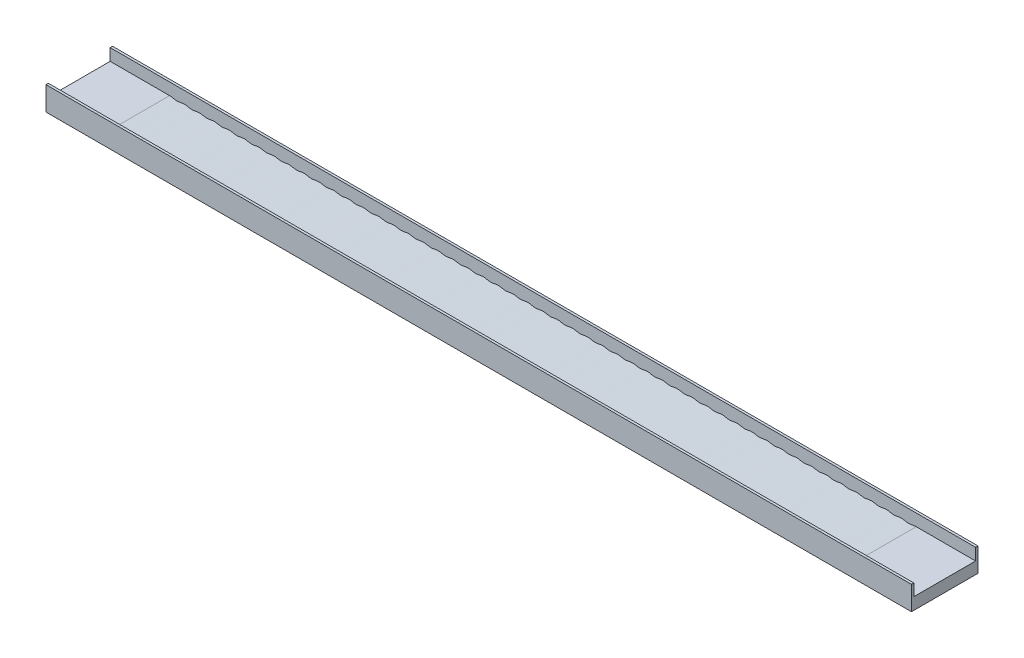
from build123d import *

# Parameters (mm, degrees)
EXTRUDE_START   = -1300
EXTRUDE_1_DEPTH = 2600
SKETCH_2_W      = 36415.926536001
SKETCH_2_H      = 1000
EXTRUDE_2_DEPTH = 100


# Read off the part's stored shape, not the designer's step: 凸台-拉伸1
with BuildPart() as part:
    # 凸台-拉伸1 outline → 凸台-拉伸1 (new body)
    with BuildSketch(Plane.XY.offset(EXTRUDE_START)):
        with BuildLine():
            Line((-2228.431761558, 20), (-2228.431761558, -480))
            Line((-2228.431761558, -480), (34187.494774443, -480))
            Line((34187.494774443, -480), (34187.494774443, 20))
            Line((34187.494774443, 20), (31687.494773895, 20))
            add(Edge.make_bspline(
                [(31687.494773895, 20), (31686.890061757, 20), (31685.675166212, 19.997851704), (31683.062154629, 19.98496191), (31679.221873173, 19.939866932), (31674.817946535, 19.849773248), (31669.718948116, 19.695711247), (31664.658657992, 19.491009688), (31659.580450049, 19.236275388), (31654.516075853, 18.932259102), (31649.448701702, 18.579852537), (31644.388230065, 18.180080275), (31639.329784909, 17.734098815), (31634.276468062, 17.243181554), (31627.964797009, 16.575112414), (31620.40032269, 15.689341218), (31609.588625545, 14.279473843), (31595.552999597, 12.189578684), (31581.558869258, 9.837617702), (31567.599816606, 7.28941057), (31553.150824515, 4.525924227), (31538.20846992, 1.568769901), (31520.787282594, -1.938535557), (31501.31254045, -5.784438998), (31482.247501309, -9.333774724), (31463.124048505, -12.556952307), (31443.930897977, -15.34178292), (31424.207399888, -17.616794123), (31403.957729748, -19.233695632), (31383.659901075, -20.065316007), (31363.344788012, -20.072105346), (31343.046405636, -19.25391055), (31322.795744152, -17.649271079), (31298.564531469, -14.867808911), (31269.436240062, -10.386147052), (31235.496124316, -3.949926792), (31202.132402779, 2.901028706), (31173.156764933, 8.478235794), (31151.571278896, 12.117923296), (31137.453877582, 14.227436657), (31122.826294393, 16.14228476), (31110.205895577, 17.526506503), (31097.560066907, 18.614869746), (31086.131702214, 19.308406214), (31078.487421897, 19.647157342), (31072.069852185, 19.844802847), (31066.93000964, 19.951171552), (31062.950475899, 19.991558407), (31055.497368984, 20.016205606), (31044.8424148, 19.877769953), (31030.581169714, 19.332419567), (31011.642094127, 17.914657935), (30991.048527765, 15.680198246), (30965.858597727, 12.103537366), (30936.148493176, 6.850524777), (30901.941099866, -0.032006323), (30867.7328091, -6.91070951), (30838.021145733, -12.15466432), (30812.829485137, -15.720192356), (30792.234915419, -17.943749607), (30773.373817468, -19.344481907), (30754.473840125, -20.059593001), (30735.56011551, -20.059593001), (30716.660138168, -19.344481907), (30697.799040216, -17.943749607), (30677.204470498, -15.720192356), (30652.012809902, -12.15466432), (30622.301146536, -6.91070951), (30588.09285577, -0.032006323), (30553.885462459, 6.850524777), (30524.175357908, 12.103537366), (30498.98542787, 15.680198246), (30478.391861509, 17.914657935), (30459.452785921, 19.332419567), (30445.198068785, 19.877798715), (30430.857712459, 20.061609484), (30416.517356133, 19.877798715), (30402.262638996, 19.332419567), (30383.323563409, 17.914657935), (30362.729997047, 15.680198246), (30337.540067009, 12.103537366), (30307.829962459, 6.850524777), (30273.622569148, -0.032006323), (30239.414278382, -6.91070951), (30209.702615015, -12.15466432), (30184.51095442, -15.720192356), (30163.916384702, -17.943749607), (30145.05528675, -19.344481907), (30126.155309407, -20.059593001), (30107.241584792, -20.059593001), (30088.34160745, -19.344481907), (30069.480509498, -17.943749607), (30048.88593978, -15.720192356), (30023.694279184, -12.15466432), (29993.982615818, -6.91070951), (29959.774325052, -0.032006323), (29925.566931741, 6.850524777), (29895.85682719, 12.103537366), (29870.666897152, 15.680198246), (29850.073330791, 17.914657935), (29831.134255203, 19.332419567), (29816.879538067, 19.877798715), (29802.539181741, 20.061609484), (29788.198825415, 19.877798715), (29773.944108278, 19.332419567), (29755.005032691, 17.914657935), (29734.411466329, 15.680198246), (29709.221536291, 12.103537366), (29679.51143174, 6.850524777), (29645.30403843, -0.032006323), (29611.095747664, -6.91070951), (29581.384084297, -12.15466432), (29556.192423702, -15.720192356), (29535.597853984, -17.943749607), (29516.736756032, -19.344481907), (29497.836778689, -20.059593001), (29478.923054074, -20.059593001), (29460.023076732, -19.344481907), (29441.16197878, -17.943749607), (29420.567409062, -15.720192356), (29395.375748466, -12.15466432), (29365.6640851, -6.91070951), (29331.455794334, -0.032006323), (29297.248401023, 6.850524777), (29267.538296472, 12.103537366), (29242.348366435, 15.680198246), (29221.754800073, 17.914657935), (29202.815724485, 19.332419567), (29188.561007349, 19.877798715), (29174.220651023, 20.061609484), (29159.880294697, 19.877798715), (29145.62557756, 19.332419567), (29126.686501973, 17.914657935), (29106.092935611, 15.680198246), (29080.903005573, 12.103537366), (29051.192901022, 6.850524777), (29016.985507712, -0.032006323), (28982.777216946, -6.91070951), (28953.065553579, -12.15466432), (28927.873892984, -15.720192356), (28907.279323266, -17.943749607), (28888.418225314, -19.344481907), (28869.518247972, -20.059593001), (28850.604523356, -20.059593001), (28831.704546014, -19.344481907), (28812.843448062, -17.943749607), (28792.248878344, -15.720192356), (28767.057217748, -12.15466432), (28737.345554382, -6.91070951), (28703.137263616, -0.032006323), (28668.929870305, 6.850524777), (28639.219765755, 12.103537366), (28614.029835717, 15.680198246), (28593.436269355, 17.914657935), (28574.497193767, 19.332419567), (28560.242476631, 19.877798715), (28545.902120305, 20.061609484), (28531.561763979, 19.877798715), (28517.307046842, 19.332419567), (28498.367971255, 17.914657935), (28477.774404893, 15.680198246), (28452.584474855, 12.103537366), (28422.874370305, 6.850524777), (28388.666976994, -0.032006323), (28354.458686228, -6.91070951), (28324.747022861, -12.15466432), (28299.555362266, -15.720192356), (28278.960792548, -17.943749607), (28260.099694596, -19.344481907), (28241.199717254, -20.059593001), (28222.285992638, -20.059593001), (28203.386015296, -19.344481907), (28184.524917344, -17.943749607), (28163.930347626, -15.720192356), (28138.73868703, -12.15466432), (28109.027023664, -6.91070951), (28074.818732898, -0.032006323), (28040.611339587, 6.850524777), (28010.901235037, 12.103537366), (27985.711304999, 15.680198246), (27965.117738637, 17.914657935), (27946.178663049, 19.332419567), (27931.923945913, 19.877798715), (27917.583589587, 20.061609484), (27903.243233261, 19.877798715), (27888.988516125, 19.332419567), (27870.049440537, 17.914657935), (27849.455874175, 15.680198246), (27824.265944137, 12.103537366), (27794.555839587, 6.850524777), (27760.348446276, -0.032006323), (27726.14015551, -6.91070951), (27696.428492143, -12.15466432), (27671.236831548, -15.720192356), (27650.64226183, -17.943749607), (27631.781163878, -19.344481907), (27612.881186536, -20.059593001), (27593.96746192, -20.059593001), (27575.067484578, -19.344481907), (27556.206386626, -17.943749607), (27535.611816908, -15.720192356), (27510.420156312, -12.15466432), (27480.708492946, -6.91070951), (27446.50020218, -0.032006323), (27412.292808869, 6.850524777), (27382.582704319, 12.103537366), (27357.392774281, 15.680198246), (27336.799207919, 17.914657935), (27317.860132331, 19.332419567), (27303.605415195, 19.877798715), (27289.265058869, 20.061609484), (27274.924702543, 19.877798715), (27260.669985407, 19.332419567), (27241.730909819, 17.914657935), (27221.137343457, 15.680198246), (27195.947413419, 12.103537366), (27166.237308869, 6.850524777), (27132.029915558, -0.032006323), (27097.821624792, -6.91070951), (27068.109961425, -12.15466432), (27042.91830083, -15.720192356), (27022.323731112, -17.943749607), (27003.46263316, -19.344481907), (26984.562655818, -20.059593001), (26965.648931202, -20.059593001), (26946.74895386, -19.344481907), (26927.887855908, -17.943749607), (26907.29328619, -15.720192356), (26882.101625594, -12.15466432), (26852.389962228, -6.91070951), (26818.181671462, -0.032006323), (26783.974278151, 6.850524777), (26754.264173601, 12.103537366), (26729.074243563, 15.680198246), (26708.480677201, 17.914657935), (26689.541601613, 19.332419567), (26675.286884477, 19.877798715), (26660.946528151, 20.061609484), (26646.606171825, 19.877798715), (26632.351454689, 19.332419567), (26613.412379101, 17.914657935), (26592.818812739, 15.680198246), (26567.628882701, 12.103537366), (26537.918778151, 6.850524777), (26503.71138484, -0.032006323), (26469.503094074, -6.91070951), (26439.791430707, -12.15466432), (26414.599770112, -15.720192356), (26394.005200394, -17.943749607), (26375.144102442, -19.344481907), (26356.2441251, -20.059593001), (26337.330400484, -20.059593001), (26318.430423142, -19.344481907), (26299.56932519, -17.943749607), (26278.974755472, -15.720192356), (26253.783094877, -12.15466432), (26224.07143151, -6.91070951), (26189.863140744, -0.032006323), (26155.655747433, 6.850524777), (26125.945642883, 12.103537366), (26100.755712845, 15.680198246), (26080.162146483, 17.914657935), (26061.223070895, 19.332419567), (26046.968353759, 19.877798715), (26032.627997433, 20.061609484), (26018.287641107, 19.877798715), (26004.032923971, 19.332419567), (25985.093848383, 17.914657935), (25964.500282021, 15.680198246), (25939.310351983, 12.103537366), (25909.600247433, 6.850524777), (25875.392854122, -0.032006323), (25841.184563356, -6.91070951), (25811.47289999, -12.15466432), (25786.281239394, -15.720192356), (25765.686669676, -17.943749607), (25746.825571724, -19.344481907), (25727.925594382, -20.059593001), (25709.011869766, -20.059593001), (25690.111892424, -19.344481907), (25671.250794472, -17.943749607), (25650.656224754, -15.720192356), (25625.464564159, -12.15466432), (25595.752900792, -6.91070951), (25561.544610026, -0.032006323), (25527.337216715, 6.850524777), (25497.627112165, 12.103537366), (25472.437182127, 15.680198246), (25451.843615765, 17.914657935), (25432.904540177, 19.332419567), (25418.649823041, 19.877798715), (25404.309466715, 20.061609484), (25389.969110389, 19.877798715), (25375.714393253, 19.332419567), (25356.775317665, 17.914657935), (25336.181751303, 15.680198246), (25310.991821265, 12.103537366), (25281.281716715, 6.850524777), (25247.074323404, -0.032006323), (25212.866032638, -6.91070951), (25183.154369271, -12.15466432), (25157.962708676, -15.720192356), (25137.368138958, -17.943749607), (25118.507041006, -19.344481907), (25099.607063664, -20.059593001), (25080.693339048, -20.059593001), (25061.793361706, -19.344481907), (25042.932263754, -17.943749607), (25022.337694036, -15.720192356), (24997.146033441, -12.15466432), (24967.434370074, -6.91070951), (24933.226079308, -0.032006323), (24899.018685997, 6.850524777), (24869.308581447, 12.103537366), (24844.118651409, 15.680198246), (24823.525085047, 17.914657935), (24804.58600946, 19.332419567), (24790.331292323, 19.877798715), (24775.990935997, 20.061609484), (24761.650579671, 19.877798715), (24747.395862535, 19.332419567), (24728.456786947, 17.914657935), (24707.863220585, 15.680198246), (24682.673290547, 12.103537366), (24652.963185997, 6.850524777), (24618.755792686, -0.032006323), (24584.54750192, -6.91070951), (24554.835838553, -12.15466432), (24529.644177958, -15.720192356), (24509.04960824, -17.943749607), (24490.188510288, -19.344481907), (24471.288532946, -20.059593001), (24452.37480833, -20.059593001), (24433.474830988, -19.344481907), (24414.613733036, -17.943749607), (24394.019163318, -15.720192356), (24368.827502723, -12.15466432), (24339.115839356, -6.91070951), (24304.90754859, -0.032006323), (24270.700155279, 6.850524777), (24240.990050729, 12.103537366), (24215.800120691, 15.680198246), (24195.206554329, 17.914657935), (24176.267478742, 19.332419567), (24162.012761605, 19.877798715), (24147.672405279, 20.061609484), (24133.332048953, 19.877798715), (24119.077331817, 19.332419567), (24100.138256229, 17.914657935), (24079.544689867, 15.680198246), (24054.35475983, 12.103537366), (24024.644655279, 6.850524777), (23990.437261968, -0.032006323), (23956.228971202, -6.91070951), (23926.517307836, -12.15466432), (23901.32564724, -15.720192356), (23880.731077522, -17.943749607), (23861.86997957, -19.344481907), (23842.970002228, -20.059593001), (23824.056277612, -20.059593001), (23805.15630027, -19.344481907), (23786.295202318, -17.943749607), (23765.7006326, -15.720192356), (23740.508972005, -12.15466432), (23710.797308638, -6.91070951), (23676.589017872, -0.032006323), (23642.381624561, 6.850524777), (23612.671520011, 12.103537366), (23587.481589973, 15.680198246), (23566.888023611, 17.914657935), (23547.948948024, 19.332419567), (23533.694230887, 19.877798715), (23519.353874561, 20.061609484), (23505.013518235, 19.877798715), (23490.758801099, 19.332419567), (23471.819725511, 17.914657935), (23451.226159149, 15.680198246), (23426.036229112, 12.103537366), (23396.326124561, 6.850524777), (23362.11873125, -0.032006323), (23327.910440484, -6.91070951), (23298.198777118, -12.15466432), (23273.007116522, -15.720192356), (23252.412546804, -17.943749607), (23233.551448852, -19.344481907), (23214.65147151, -20.059593001), (23195.737746895, -20.059593001), (23176.837769552, -19.344481907), (23157.9766716, -17.943749607), (23137.382101882, -15.720192356), (23112.190441287, -12.15466432), (23082.47877792, -6.91070951), (23048.270487154, -0.032006323), (23014.063093843, 6.850524777), (22984.352989293, 12.103537366), (22959.163059255, 15.680198246), (22938.569492893, 17.914657935), (22919.630417306, 19.332419567), (22905.375700169, 19.877798715), (22891.035343843, 20.061609484), (22876.694987517, 19.877798715), (22862.440270381, 19.332419567), (22843.501194793, 17.914657935), (22822.907628432, 15.680198246), (22797.717698393, 12.103537366), (22768.007593843, 6.850524777), (22733.800200532, -0.032006323), (22699.591909766, -6.91070951), (22669.8802464, -12.15466432), (22644.688585804, -15.720192356), (22624.094016086, -17.943749607), (22605.232918134, -19.344481907), (22586.332940792, -20.059593001), (22567.419216176, -20.059593001), (22548.519238834, -19.344481907), (22529.658140883, -17.943749607), (22509.063571165, -15.720192356), (22483.871910569, -12.15466432), (22454.160247202, -6.91070951), (22419.951956436, -0.032006323), (22385.744563125, 6.850524777), (22356.034458575, 12.103537366), (22330.844528537, 15.680198246), (22310.250962175, 17.914657935), (22291.311886588, 19.332419567), (22277.057169451, 19.877798715), (22262.716813125, 20.061609484), (22248.376456799, 19.877798715), (22234.121739663, 19.332419567), (22215.182664075, 17.914657935), (22194.589097713, 15.680198246), (22169.399167676, 12.103537366), (22139.689063125, 6.850524777), (22105.481669814, -0.032006323), (22071.273379048, -6.91070951), (22041.561715682, -12.15466432), (22016.370055086, -15.720192356), (21995.775485368, -17.943749607), (21976.914387416, -19.344481907), (21958.014410074, -20.059593001), (21939.100685459, -20.059593001), (21920.200708116, -19.344481907), (21901.339610165, -17.943749607), (21880.745040447, -15.720192356), (21855.553379851, -12.15466432), (21825.841716484, -6.91070951), (21791.633425718, -0.032006323), (21757.426032408, 6.850524777), (21727.715927857, 12.103537366), (21702.525997819, 15.680198246), (21681.932431457, 17.914657935), (21662.99335587, 19.332419567), (21648.738638733, 19.877798715), (21634.398282407, 20.061609484), (21620.057926081, 19.877798715), (21605.803208945, 19.332419567), (21586.864133357, 17.914657935), (21566.270566996, 15.680198246), (21541.080636958, 12.103537366), (21511.370532407, 6.850524777), (21477.163139096, -0.032006323), (21442.95484833, -6.91070951), (21413.243184964, -12.15466432), (21388.051524368, -15.720192356), (21367.45695465, -17.943749607), (21348.595856698, -19.344481907), (21329.695879356, -20.059593001), (21310.782154741, -20.059593001), (21291.882177398, -19.344481907), (21273.021079447, -17.943749607), (21252.426509729, -15.720192356), (21227.234849133, -12.15466432), (21197.523185766, -6.91070951), (21163.314895, -0.032006323), (21129.10750169, 6.850524777), (21099.397397139, 12.103537366), (21074.207467101, 15.680198246), (21053.613900739, 17.914657935), (21034.674825152, 19.332419567), (21020.420108015, 19.877798715), (21006.079751689, 20.061609484), (20991.739395363, 19.877798715), (20977.484678227, 19.332419567), (20958.545602639, 17.914657935), (20937.952036278, 15.680198246), (20912.76210624, 12.103537366), (20883.052001689, 6.850524777), (20848.844608378, -0.032006323), (20814.636317612, -6.91070951), (20784.924654246, -12.15466432), (20759.73299365, -15.720192356), (20739.138423932, -17.943749607), (20720.27732598, -19.344481907), (20701.377348638, -20.059593001), (20682.463624023, -20.059593001), (20663.56364668, -19.344481907), (20644.702548729, -17.943749607), (20624.107979011, -15.720192356), (20598.916318415, -12.15466432), (20569.204655048, -6.91070951), (20534.996364282, -0.032006323), (20500.788970972, 6.850524777), (20471.078866421, 12.103537366), (20445.888936383, 15.680198246), (20425.295370021, 17.914657935), (20406.356294434, 19.332419567), (20392.101577297, 19.877798715), (20377.761220971, 20.061609484), (20363.420864645, 19.877798715), (20349.166147509, 19.332419567), (20330.227071921, 17.914657935), (20309.63350556, 15.680198246), (20284.443575522, 12.103537366), (20254.733470971, 6.850524777), (20220.52607766, -0.032006323), (20186.317786894, -6.91070951), (20156.606123528, -12.15466432), (20131.414462932, -15.720192356), (20110.819893214, -17.943749607), (20091.958795263, -19.344481907), (20073.05881792, -20.059593001), (20054.145093305, -20.059593001), (20035.245115962, -19.344481907), (20016.384018011, -17.943749607), (19995.789448293, -15.720192356), (19970.597787697, -12.15466432), (19940.88612433, -6.91070951), (19906.677833564, -0.032006323), (19872.470440254, 6.850524777), (19842.760335703, 12.103537366), (19817.570405665, 15.680198246), (19796.976839304, 17.914657935), (19778.037763716, 19.332419567), (19763.783046579, 19.877798715), (19749.442690253, 20.061609484), (19735.102333927, 19.877798715), (19720.847616791, 19.332419567), (19701.908541203, 17.914657935), (19681.314974842, 15.680198246), (19656.125044804, 12.103537366), (19626.414940253, 6.850524777), (19592.207546942, -0.032006323), (19557.999256176, -6.91070951), (19528.28759281, -12.15466432), (19503.095932214, -15.720192356), (19482.501362496, -17.943749607), (19463.640264545, -19.344481907), (19444.740287202, -20.059593001), (19425.826562587, -20.059593001), (19406.926585244, -19.344481907), (19388.065487293, -17.943749607), (19367.470917575, -15.720192356), (19342.279256979, -12.15466432), (19312.567593612, -6.91070951), (19278.359302846, -0.032006323), (19244.151909536, 6.850524777), (19214.441804985, 12.103537366), (19189.251874947, 15.680198246), (19168.658308586, 17.914657935), (19149.719232998, 19.332419567), (19135.464515861, 19.877798715), (19121.124159535, 20.061609484), (19106.783803209, 19.877798715), (19092.529086073, 19.332419567), (19073.590010485, 17.914657935), (19052.996444124, 15.680198246), (19027.806514086, 12.103537366), (18998.096409535, 6.850524777), (18963.889016225, -0.032006323), (18929.680725459, -6.91070951), (18899.969062092, -12.15466432), (18874.777401496, -15.720192356), (18854.182831778, -17.943749607), (18835.321733827, -19.344481907), (18816.421756484, -20.059593001), (18797.508031869, -20.059593001), (18778.608054526, -19.344481907), (18759.746956575, -17.943749607), (18739.152386857, -15.720192356), (18713.960726261, -12.15466432), (18684.249062894, -6.91070951), (18650.040772128, -0.032006323), (18615.833378818, 6.850524777), (18586.123274267, 12.103537366), (18560.933344229, 15.680198246), (18540.339777868, 17.914657935), (18521.40070228, 19.332419567), (18507.145985143, 19.877798715), (18492.805628817, 20.061609484), (18478.465272491, 19.877798715), (18464.210555355, 19.332419567), (18445.271479767, 17.914657935), (18424.677913406, 15.680198246), (18399.487983368, 12.103537366), (18369.777878817, 6.850524777), (18335.570485507, -0.032006323), (18301.362194741, -6.91070951), (18271.650531374, -12.15466432), (18246.458870778, -15.720192356), (18225.86430106, -17.943749607), (18207.003203109, -19.344481907), (18188.103225766, -20.059593001), (18169.189501151, -20.059593001), (18150.289523808, -19.344481907), (18131.428425857, -17.943749607), (18110.833856139, -15.720192356), (18085.642195543, -12.15466432), (18055.930532176, -6.91070951), (18021.72224141, -0.032006323), (17987.5148481, 6.850524777), (17957.804743549, 12.103537366), (17932.614813511, 15.680198246), (17912.02124715, 17.914657935), (17893.082171562, 19.332419567), (17878.827454426, 19.877798715), (17864.4870981, 20.061609484), (17850.146741774, 19.877798715), (17835.892024637, 19.332419567), (17816.952949049, 17.914657935), (17796.359382688, 15.680198246), (17771.16945265, 12.103537366), (17741.459348099, 6.850524777), (17707.251954789, -0.032006323), (17673.043664023, -6.91070951), (17643.332000656, -12.15466432), (17618.14034006, -15.720192356), (17597.545770342, -17.943749607), (17578.684672391, -19.344481907), (17559.784695048, -20.059593001), (17540.870970433, -20.059593001), (17521.970993091, -19.344481907), (17503.109895139, -17.943749607), (17482.515325421, -15.720192356), (17457.323664825, -12.15466432), (17427.612001458, -6.91070951), (17393.403710692, -0.032006323), (17359.196317382, 6.850524777), (17329.486212831, 12.103537366), (17304.296282793, 15.680198246), (17283.702716432, 17.914657935), (17264.763640844, 19.332419567), (17250.508923708, 19.877798715), (17236.168567382, 20.061609484), (17221.828211056, 19.877798715), (17207.573493919, 19.332419567), (17188.634418332, 17.914657935), (17168.04085197, 15.680198246), (17142.850921932, 12.103537366), (17113.140817381, 6.850524777), (17078.933424071, -0.032006323), (17044.725133305, -6.91070951), (17015.013469938, -12.15466432), (16989.821809342, -15.720192356), (16969.227239624, -17.943749607), (16950.366141673, -19.344481907), (16931.46616433, -20.059593001), (16912.552439715, -20.059593001), (16893.652462373, -19.344481907), (16874.791364421, -17.943749607), (16854.196794703, -15.720192356), (16829.005134107, -12.15466432), (16799.293470741, -6.91070951), (16765.085179974, -0.032006323), (16730.877786664, 6.850524777), (16701.167682113, 12.103537366), (16675.977752075, 15.680198246), (16655.384185714, 17.914657935), (16636.445110126, 19.332419567), (16622.19039299, 19.877798715), (16607.850036664, 20.061609484), (16593.509680338, 19.877798715), (16579.254963201, 19.332419567), (16560.315887613, 17.914657935), (16539.722321252, 15.680198246), (16514.532391214, 12.103537366), (16484.822286663, 6.850524777), (16450.614893353, -0.032006323), (16416.406602587, -6.91070951), (16386.69493922, -12.15466432), (16361.503278624, -15.720192356), (16340.908708906, -17.943749607), (16322.047610955, -19.344481907), (16303.147633612, -20.059593001), (16284.233908997, -20.059593001), (16265.333931655, -19.344481907), (16246.472833703, -17.943749607), (16225.878263985, -15.720192356), (16200.686603389, -12.15466432), (16170.974940023, -6.91070951), (16136.766649257, -0.032006323), (16102.559255946, 6.850524777), (16072.849151395, 12.103537366), (16047.659221357, 15.680198246), (16027.065654996, 17.914657935), (16008.126579408, 19.332419567), (15993.871862272, 19.877798715), (15979.531505946, 20.061609484), (15965.19114962, 19.877798715), (15950.936432483, 19.332419567), (15931.997356895, 17.914657935), (15911.403790534, 15.680198246), (15886.213860496, 12.103537366), (15856.503755945, 6.850524777), (15822.296362635, -0.032006323), (15788.088071869, -6.91070951), (15758.376408502, -12.15466432), (15733.184747906, -15.720192356), (15712.590178188, -17.943749607), (15693.729080237, -19.344481907), (15674.829102894, -20.059593001), (15655.915378279, -20.059593001), (15637.015400937, -19.344481907), (15618.154302985, -17.943749607), (15597.559733267, -15.720192356), (15572.368072671, -12.15466432), (15542.656409305, -6.91070951), (15508.448118538, -0.032006323), (15474.240725228, 6.850524777), (15444.530620677, 12.103537366), (15419.340690639, 15.680198246), (15398.747124278, 17.914657935), (15379.80804869, 19.332419567), (15365.553331554, 19.877798715), (15351.212975228, 20.061609484), (15336.872618902, 19.877798715), (15322.617901765, 19.332419567), (15303.678826178, 17.914657935), (15283.085259816, 15.680198246), (15257.895329778, 12.103537366), (15228.185225227, 6.850524777), (15193.977831917, -0.032006323), (15159.769541151, -6.91070951), (15130.057877784, -12.15466432), (15104.866217189, -15.720192356), (15084.27164747, -17.943749607), (15065.410549519, -19.344481907), (15046.510572176, -20.059593001), (15027.596847561, -20.059593001), (15008.696870219, -19.344481907), (14989.835772267, -17.943749607), (14969.241202549, -15.720192356), (14944.049541953, -12.15466432), (14914.337878587, -6.91070951), (14880.129587821, -0.032006323), (14845.92219451, 6.850524777), (14816.212089959, 12.103537366), (14791.022159921, 15.680198246), (14770.42859356, 17.914657935), (14751.489517972, 19.332419567), (14737.234800836, 19.877798715), (14722.89444451, 20.061609484), (14708.554088184, 19.877798715), (14694.299371047, 19.332419567), (14675.36029546, 17.914657935), (14654.766729098, 15.680198246), (14629.57679906, 12.103537366), (14599.866694509, 6.850524777), (14565.659301199, -0.032006323), (14531.451010433, -6.91070951), (14501.739347066, -12.15466432), (14476.54768647, -15.720192356), (14455.953116753, -17.943749607), (14437.092018801, -19.344481907), (14418.192041458, -20.059593001), (14399.278316843, -20.059593001), (14380.378339501, -19.344481907), (14361.517241549, -17.943749607), (14340.922671831, -15.720192356), (14315.731011235, -12.15466432), (14286.019347869, -6.91070951), (14251.811057103, -0.032006323), (14217.603663792, 6.850524777), (14187.893559241, 12.103537366), (14162.703629204, 15.680198246), (14142.110062842, 17.914657935), (14123.170987254, 19.332419567), (14108.916270118, 19.877798715), (14094.575913792, 20.061609484), (14080.235557466, 19.877798715), (14065.980840329, 19.332419567), (14047.041764742, 17.914657935), (14026.44819838, 15.680198246), (14001.258268342, 12.103537366), (13971.548163791, 6.850524777), (13937.340770481, -0.032006323), (13903.132479715, -6.91070951), (13873.420816348, -12.15466432), (13848.229155753, -15.720192356), (13827.634586035, -17.943749607), (13808.773488083, -19.344481907), (13789.87351074, -20.059593001), (13770.959786125, -20.059593001), (13752.059808783, -19.344481907), (13733.198710831, -17.943749607), (13712.604141113, -15.720192356), (13687.412480517, -12.15466432), (13657.700817151, -6.91070951), (13623.492526385, -0.032006323), (13589.285133074, 6.850524777), (13559.575028523, 12.103537366), (13534.385098485, 15.680198246), (13513.791532124, 17.914657935), (13494.852456536, 19.332419567), (13480.5977394, 19.877798715), (13466.257383074, 20.061609484), (13451.917026748, 19.877798715), (13437.662309611, 19.332419567), (13418.723234024, 17.914657935), (13398.129667662, 15.680198246), (13372.939737624, 12.103537366), (13343.229633074, 6.850524777), (13309.022239763, -0.032006323), (13274.813948997, -6.91070951), (13245.10228563, -12.15466432), (13219.910625035, -15.720192356), (13199.316055317, -17.943749607), (13180.454957365, -19.344481907), (13161.554980022, -20.059593001), (13142.641255407, -20.059593001), (13123.741278065, -19.344481907), (13104.880180113, -17.943749607), (13084.285610395, -15.720192356), (13059.093949799, -12.15466432), (13029.382286433, -6.91070951), (12995.173995667, -0.032006323), (12960.966602356, 6.850524777), (12931.256497805, 12.103537366), (12906.066567768, 15.680198246), (12885.473001406, 17.914657935), (12866.533925818, 19.332419567), (12852.279208682, 19.877798715), (12837.938852356, 20.061609484), (12823.59849603, 19.877798715), (12809.343778893, 19.332419567), (12790.404703306, 17.914657935), (12769.811136944, 15.680198246), (12744.621206906, 12.103537366), (12714.911102356, 6.850524777), (12680.703709045, -0.032006323), (12646.495418279, -6.91070951), (12616.783754912, -12.15466432), (12591.592094317, -15.720192356), (12570.997524599, -17.943749607), (12552.136426647, -19.344481907), (12533.236449305, -20.059593001), (12514.322724689, -20.059593001), (12495.422747347, -19.344481907), (12476.561649395, -17.943749607), (12455.967079677, -15.720192356), (12430.775419081, -12.15466432), (12401.063755715, -6.91070951), (12366.855464949, -0.032006323), (12332.648071638, 6.850524777), (12302.937967088, 12.103537366), (12277.74803705, 15.680198246), (12257.154470688, 17.914657935), (12238.2153951, 19.332419567), (12223.960677964, 19.877798715), (12209.620321638, 20.061609484), (12195.279965312, 19.877798715), (12181.025248175, 19.332419567), (12162.086172588, 17.914657935), (12141.492606226, 15.680198246), (12116.302676188, 12.103537366), (12086.592571638, 6.850524777), (12052.385178327, -0.032006323), (12018.176887561, -6.91070951), (11988.465224194, -12.15466432), (11963.273563599, -15.720192356), (11942.678993881, -17.943749607), (11923.817895929, -19.344481907), (11904.917918587, -20.059593001), (11886.004193971, -20.059593001), (11867.104216629, -19.344481907), (11848.243118677, -17.943749607), (11827.648548959, -15.720192356), (11802.456888364, -12.15466432), (11772.745224997, -6.91070951), (11738.536934231, -0.032006323), (11704.32954092, 6.850524777), (11674.61943637, 12.103537366), (11649.429506332, 15.680198246), (11628.83593997, 17.914657935), (11609.896864382, 19.332419567), (11595.642147246, 19.877798715), (11581.30179092, 20.061609484), (11566.961434594, 19.877798715), (11552.706717458, 19.332419567), (11533.76764187, 17.914657935), (11513.174075508, 15.680198246), (11487.98414547, 12.103537366), (11458.27404092, 6.850524777), (11424.066647609, -0.032006323), (11389.858356843, -6.91070951), (11360.146693476, -12.15466432), (11334.955032881, -15.720192356), (11314.360463163, -17.943749607), (11295.499365211, -19.344481907), (11276.599387869, -20.059593001), (11257.685663253, -20.059593001), (11238.785685911, -19.344481907), (11219.924587959, -17.943749607), (11199.330018241, -15.720192356), (11174.138357645, -12.15466432), (11144.426694279, -6.91070951), (11110.218403513, -0.032006323), (11076.011010202, 6.850524777), (11046.300905652, 12.103537366), (11021.110975614, 15.680198246), (11000.517409252, 17.914657935), (10981.578333664, 19.332419567), (10967.323616528, 19.877798715), (10952.983260202, 20.061609484), (10938.642903876, 19.877798715), (10924.38818674, 19.332419567), (10905.449111152, 17.914657935), (10884.85554479, 15.680198246), (10859.665614752, 12.103537366), (10829.955510202, 6.850524777), (10795.748116891, -0.032006323), (10761.539826125, -6.91070951), (10731.828162758, -12.15466432), (10706.636502163, -15.720192356), (10686.041932445, -17.943749607), (10667.180834493, -19.344481907), (10648.280857151, -20.059593001), (10629.367132535, -20.059593001), (10610.467155193, -19.344481907), (10591.606057241, -17.943749607), (10571.011487523, -15.720192356), (10545.819826927, -12.15466432), (10516.108163561, -6.91070951), (10481.899872795, -0.032006323), (10447.692479484, 6.850524777), (10417.982374934, 12.103537366), (10392.792444896, 15.680198246), (10372.198878534, 17.914657935), (10353.259802946, 19.332419567), (10339.00508581, 19.877798715), (10324.664729484, 20.061609484), (10310.324373158, 19.877798715), (10296.069656022, 19.332419567), (10277.130580434, 17.914657935), (10256.537014072, 15.680198246), (10231.347084034, 12.103537366), (10201.636979484, 6.850524777), (10167.429586173, -0.032006323), (10133.221295407, -6.91070951), (10103.50963204, -12.15466432), (10078.317971445, -15.720192356), (10057.723401727, -17.943749607), (10038.862303775, -19.344481907), (10019.962326433, -20.059593001), (10001.048601817, -20.059593001), (9982.148624475, -19.344481907), (9963.287526523, -17.943749607), (9942.692956805, -15.720192356), (9917.50129621, -12.15466432), (9887.789632843, -6.91070951), (9853.581342077, -0.032006323), (9819.373948766, 6.850524777), (9789.663844216, 12.103537366), (9764.473914178, 15.680198246), (9743.880347816, 17.914657935), (9724.941272228, 19.332419567), (9710.686555092, 19.877798715), (9696.346198766, 20.061609484), (9682.00584244, 19.877798715), (9667.751125304, 19.332419567), (9648.812049716, 17.914657935), (9628.218483354, 15.680198246), (9603.028553316, 12.103537366), (9573.318448766, 6.850524777), (9539.111055455, -0.032006323), (9504.902764689, -6.91070951), (9475.191101323, -12.15466432), (9449.999440727, -15.720192356), (9429.404871009, -17.943749607), (9410.543773057, -19.344481907), (9391.643795715, -20.059593001), (9372.730071099, -20.059593001), (9353.830093757, -19.344481907), (9334.968995805, -17.943749607), (9314.374426087, -15.720192356), (9289.182765492, -12.15466432), (9259.471102125, -6.91070951), (9225.262811359, -0.032006323), (9191.055418048, 6.850524777), (9161.345313498, 12.103537366), (9136.15538346, 15.680198246), (9115.561817098, 17.914657935), (9096.62274151, 19.332419567), (9082.368024374, 19.877798715), (9068.027668048, 20.061609484), (9053.687311722, 19.877798715), (9039.432594586, 19.332419567), (9020.493518998, 17.914657935), (8999.899952636, 15.680198246), (8974.710022598, 12.103537366), (8944.999918048, 6.850524777), (8910.792524737, -0.032006323), (8876.584233971, -6.91070951), (8846.872570605, -12.15466432), (8821.680910009, -15.720192356), (8801.086340291, -17.943749607), (8782.225242339, -19.344481907), (8763.325264997, -20.059593001), (8744.411540381, -20.059593001), (8725.511563039, -19.344481907), (8706.650465087, -17.943749607), (8686.055895369, -15.720192356), (8660.864234774, -12.15466432), (8631.152571407, -6.91070951), (8596.944280641, -0.032006323), (8562.73688733, 6.850524777), (8533.02678278, 12.103537366), (8507.836852742, 15.680198246), (8487.24328638, 17.914657935), (8468.304210793, 19.332419567), (8454.049493656, 19.877798715), (8439.70913733, 20.061609484), (8425.368781004, 19.877798715), (8411.114063868, 19.332419567), (8392.17498828, 17.914657935), (8371.581421918, 15.680198246), (8346.39149188, 12.103537366), (8316.68138733, 6.850524777), (8282.473994019, -0.032006323), (8248.265703253, -6.91070951), (8218.554039887, -12.15466432), (8193.362379291, -15.720192356), (8172.767809573, -17.943749607), (8153.906711621, -19.344481907), (8135.006734279, -20.059593001), (8116.093009663, -20.059593001), (8097.193032321, -19.344481907), (8078.331934369, -17.943749607), (8057.737364651, -15.720192356), (8032.545704056, -12.15466432), (8002.834040689, -6.91070951), (7968.625749923, -0.032006323), (7934.418356612, 6.850524777), (7904.708252062, 12.103537366), (7879.518322024, 15.680198246), (7858.924755662, 17.914657935), (7839.985680075, 19.332419567), (7825.730962938, 19.877798715), (7811.390606612, 20.061609484), (7797.050250286, 19.877798715), (7782.79553315, 19.332419567), (7763.856457562, 17.914657935), (7743.2628912, 15.680198246), (7718.072961163, 12.103537366), (7688.362856612, 6.850524777), (7654.155463301, -0.032006323), (7619.947172535, -6.91070951), (7590.235509169, -12.15466432), (7565.043848573, -15.720192356), (7544.449278855, -17.943749607), (7525.588180903, -19.344481907), (7506.688203561, -20.059593001), (7487.774478946, -20.059593001), (7468.874501603, -19.344481907), (7450.013403651, -17.943749607), (7429.418833933, -15.720192356), (7404.227173338, -12.15466432), (7374.515509971, -6.91070951), (7340.307219205, -0.032006323), (7306.099825894, 6.850524777), (7276.389721344, 12.103537366), (7251.199791306, 15.680198246), (7230.606224944, 17.914657935), (7211.667149357, 19.332419567), (7197.41243222, 19.877798715), (7183.072075894, 20.061609484), (7168.731719568, 19.877798715), (7154.477002432, 19.332419567), (7135.537926844, 17.914657935), (7114.944360483, 15.680198246), (7089.754430445, 12.103537366), (7060.044325894, 6.850524777), (7025.836932583, -0.032006323), (6991.628641817, -6.91070951), (6961.916978451, -12.15466432), (6936.725317855, -15.720192356), (6916.130748137, -17.943749607), (6897.269650185, -19.344481907), (6878.369672843, -20.059593001), (6859.455948228, -20.059593001), (6840.555970885, -19.344481907), (6821.694872933, -17.943749607), (6801.100303216, -15.720192356), (6775.90864262, -12.15466432), (6746.196979253, -6.91070951), (6711.988688487, -0.032006323), (6677.781295177, 6.850524777), (6648.071190626, 12.103537366), (6622.881260588, 15.680198246), (6602.287694226, 17.914657935), (6583.348618639, 19.332419567), (6569.093901502, 19.877798715), (6554.753545176, 20.061609484), (6540.41318885, 19.877798715), (6526.158471714, 19.332419567), (6507.219396126, 17.914657935), (6486.625829765, 15.680198246), (6461.435899727, 12.103537366), (6431.725795176, 6.850524777), (6397.518401865, -0.032006323), (6363.310111099, -6.91070951), (6333.598447733, -12.15466432), (6308.406787137, -15.720192356), (6287.812217419, -17.943749607), (6268.951119467, -19.344481907), (6250.051142125, -20.059593001), (6231.13741751, -20.059593001), (6212.237440167, -19.344481907), (6193.376342216, -17.943749607), (6172.781772498, -15.720192356), (6147.590111902, -12.15466432), (6117.878448535, -6.91070951), (6083.670157769, -0.032006323), (6049.462764459, 6.850524777), (6019.752659908, 12.103537366), (5994.56272987, 15.680198246), (5973.969163508, 17.914657935), (5955.030087921, 19.332419567), (5940.775370784, 19.877798715), (5926.435014458, 20.061609484), (5912.094658132, 19.877798715), (5897.839940996, 19.332419567), (5878.900865408, 17.914657935), (5858.307299047, 15.680198246), (5833.117369009, 12.103537366), (5803.407264458, 6.850524777), (5769.199871147, -0.032006323), (5734.991580381, -6.91070951), (5705.279917015, -12.15466432), (5680.088256419, -15.720192356), (5659.493686701, -17.943749607), (5640.632588749, -19.344481907), (5621.732611407, -20.059593001), (5602.818886792, -20.059593001), (5583.918909449, -19.344481907), (5565.057811498, -17.943749607), (5544.46324178, -15.720192356), (5519.271581184, -12.15466432), (5489.559917817, -6.91070951), (5455.351627051, -0.032006323), (5421.144233741, 6.850524777), (5391.43412919, 12.103537366), (5366.244199152, 15.680198246), (5345.65063279, 17.914657935), (5326.711557203, 19.332419567), (5312.456840066, 19.877798715), (5298.11648374, 20.061609484), (5283.776127414, 19.877798715), (5269.521410278, 19.332419567), (5250.58233469, 17.914657935), (5229.988768329, 15.680198246), (5204.798838291, 12.103537366), (5175.08873374, 6.850524777), (5140.881340429, -0.032006323), (5106.673049663, -6.91070951), (5076.961386297, -12.15466432), (5051.769725701, -15.720192356), (5031.175155983, -17.943749607), (5012.314058031, -19.344481907), (4993.414080689, -20.059593001), (4974.500356074, -20.059593001), (4955.600378731, -19.344481907), (4936.73928078, -17.943749607), (4916.144711062, -15.720192356), (4890.953050466, -12.15466432), (4861.241387099, -6.91070951), (4827.033096333, -0.032006323), (4792.825703023, 6.850524777), (4763.115598472, 12.103537366), (4737.925668434, 15.680198246), (4717.332102072, 17.914657935), (4698.393026485, 19.332419567), (4684.138309348, 19.877798715), (4669.797953022, 20.061609484), (4655.457596696, 19.877798715), (4641.20287956, 19.332419567), (4622.263803972, 17.914657935), (4601.670237611, 15.680198246), (4576.480307573, 12.103537366), (4546.770203022, 6.850524777), (4512.562809712, -0.032006323), (4478.354518945, -6.91070951), (4448.642855579, -12.15466432), (4423.451194983, -15.720192356), (4402.856625265, -17.943749607), (4383.995527314, -19.344481907), (4365.095549971, -20.059593001), (4346.181825356, -20.059593001), (4327.281848013, -19.344481907), (4308.420750062, -17.943749607), (4287.826180344, -15.720192356), (4262.634519748, -12.15466432), (4232.922856381, -6.91070951), (4198.714565615, -0.032006323), (4164.507172305, 6.850524777), (4134.797067754, 12.103537366), (4109.607137716, 15.680198246), (4089.013571355, 17.914657935), (4070.074495767, 19.332419567), (4055.81977863, 19.877798715), (4041.479422304, 20.061609484), (4027.139065978, 19.877798715), (4012.884348842, 19.332419567), (3993.945273254, 17.914657935), (3973.351706893, 15.680198246), (3948.161776855, 12.103537366), (3918.451672304, 6.850524777), (3884.244278994, -0.032006323), (3850.035988228, -6.91070951), (3820.324324861, -12.15466432), (3795.132664265, -15.720192356), (3774.538094547, -17.943749607), (3755.676996596, -19.344481907), (3736.777019253, -20.059593001), (3717.863294638, -20.059593001), (3698.963317295, -19.344481907), (3680.102219344, -17.943749607), (3659.507649626, -15.720192356), (3634.31598903, -12.15466432), (3604.604325663, -6.91070951), (3570.396034897, -0.032006323), (3536.188641587, 6.850524777), (3506.478537036, 12.103537366), (3481.288606998, 15.680198246), (3460.695040637, 17.914657935), (3441.755965049, 19.332419567), (3427.501247912, 19.877798715), (3413.160891586, 20.061609484), (3398.82053526, 19.877798715), (3384.565818124, 19.332419567), (3365.626742536, 17.914657935), (3345.033176175, 15.680198246), (3319.843246137, 12.103537366), (3290.133141586, 6.850524777), (3255.925748276, -0.032006323), (3221.71745751, -6.91070951), (3192.005794143, -12.15466432), (3166.814133547, -15.720192356), (3146.219563829, -17.943749607), (3127.358465878, -19.344481907), (3108.458488535, -20.059593001), (3089.54476392, -20.059593001), (3070.644786577, -19.344481907), (3051.783688626, -17.943749607), (3031.189118908, -15.720192356), (3005.997458312, -12.15466432), (2976.285794945, -6.91070951), (2942.077504179, -0.032006323), (2907.870110869, 6.850524777), (2878.160006318, 12.103537366), (2852.97007628, 15.680198246), (2832.376509919, 17.914657935), (2813.437434331, 19.332419567), (2799.182717194, 19.877798715), (2784.842360868, 20.061609484), (2770.502004542, 19.877798715), (2756.247287406, 19.332419567), (2737.308211818, 17.914657935), (2716.714645457, 15.680198246), (2691.524715419, 12.103537366), (2661.814610868, 6.850524777), (2627.607217558, -0.032006323), (2593.398926792, -6.91070951), (2563.687263425, -12.15466432), (2538.495602829, -15.720192356), (2517.901033111, -17.943749607), (2499.03993516, -19.344481907), (2480.139957817, -20.059593001), (2461.226233202, -20.059593001), (2442.326255859, -19.344481907), (2423.465157908, -17.943749607), (2402.87058819, -15.720192356), (2377.678927594, -12.15466432), (2347.967264227, -6.91070951), (2313.758973461, -0.032006323), (2279.551580151, 6.850524777), (2249.8414756, 12.103537366), (2224.651545562, 15.680198246), (2204.057979201, 17.914657935), (2185.118903613, 19.332419567), (2170.864186477, 19.877798715), (2156.523830151, 20.061609484), (2142.183473825, 19.877798715), (2127.928756688, 19.332419567), (2108.9896811, 17.914657935), (2088.396114739, 15.680198246), (2063.206184701, 12.103537366), (2033.49608015, 6.850524777), (1999.28868684, -0.032006323), (1965.080396074, -6.91070951), (1935.368732707, -12.15466432), (1910.177072111, -15.720192356), (1889.582502393, -17.943749607), (1870.721404442, -19.344481907), (1851.821427099, -20.059593001), (1832.907702484, -20.059593001), (1814.007725141, -19.344481907), (1795.14662719, -17.943749607), (1774.552057472, -15.720192356), (1749.360396876, -12.15466432), (1719.64873351, -6.91070951), (1685.440442743, -0.032006323), (1651.233049433, 6.850524777), (1621.522944882, 12.103537366), (1596.333014844, 15.680198246), (1575.739448483, 17.914657935), (1556.800372895, 19.332419567), (1542.545655759, 19.877798715), (1528.205299433, 20.061609484), (1513.864943107, 19.877798715), (1499.61022597, 19.332419567), (1480.671150382, 17.914657935), (1460.077584021, 15.680198246), (1434.887653983, 12.103537366), (1405.177549432, 6.850524777), (1370.970156122, -0.032006323), (1336.761865356, -6.91070951), (1307.050201989, -12.15466432), (1281.858541393, -15.720192356), (1261.263971675, -17.943749607), (1242.402873724, -19.344481907), (1223.502896381, -20.059593001), (1204.589171766, -20.059593001), (1185.689194424, -19.344481907), (1166.828096472, -17.943749607), (1146.233526754, -15.720192356), (1121.041866158, -12.15466432), (1091.330202792, -6.91070951), (1057.121912025, -0.032006323), (1022.914518715, 6.850524777), (993.204414164, 12.103537366), (968.014484126, 15.680198246), (947.420917765, 17.914657935), (928.481842177, 19.332419567), (914.220597092, 19.877769953), (903.565642908, 20.016205606), (896.112535992, 19.991558407), (892.133002251, 19.951171552), (886.993159706, 19.844802847), (880.575589994, 19.647157342), (872.931309677, 19.308406214), (861.502944985, 18.614869746), (848.857116314, 17.526506503), (836.236717498, 16.14228476), (821.609134309, 14.227436657), (807.491732996, 12.117923296), (785.906246959, 8.478235795), (756.930609111, 2.901028706), (723.566887576, -3.949926791), (689.626771827, -10.386147053), (660.498480424, -14.86780891), (636.267267735, -17.64927108), (616.016606262, -19.253910548), (595.718223867, -20.07210535), (575.403110837, -20.065316), (555.105282108, -19.233695643), (534.855612061, -17.616794105), (515.132113816, -15.341782951), (495.938963559, -12.556952251), (476.815510241, -9.333774833), (457.75047215, -5.784438782), (440.766329565, -2.430382927), (425.832022004, 0.566679365), (413.383366633, 3.047349157), (403.418683105, 5.002826794), (391.463201104, 7.289409727), (377.504132067, 9.837619374), (364.761888906, 11.979178604), (353.241102514, 13.718613074), (344.955126409, 14.859612537), (339.920236218, 15.515292405), (333.620482639, 16.286460945), (326.051239471, 17.130989676), (318.470548291, 17.868409746), (310.879867886, 18.491750956), (304.548286682, 18.932259063), (299.480135783, 19.236275416), (294.408746657, 19.491009668), (289.97007574, 19.670123567), (286.163975393, 19.791999991), (282.988721796, 19.872320694), (280.456477714, 19.923783585), (277.931623742, 19.962414422), (275.342201103, 19.988184359), (273.387275063, 19.997851704), (272.172950134, 20), (271.568237997, 20)],
                knots=[0.000944041, 0.000944041, 0.000944041, 0.000944041, 0.000944041, 0.001020279, 0.001096517, 0.001248992, 0.001401467, 0.001553942, 0.001706417, 0.001858893, 0.002011368, 0.002163843, 0.002316318, 0.002468793, 0.002621269, 0.002773744, 0.003078694, 0.003383645, 0.003930928, 0.00447821, 0.004783161, 0.005088111, 0.005698012, 0.006307913, 0.006917814, 0.007472611, 0.008027408, 0.008637309, 0.00924721, 0.009857111, 0.010467011, 0.011076912, 0.011686813, 0.012296713, 0.012906615, 0.01400619, 0.015225991, 0.016445793, 0.016998086, 0.017550378, 0.017855328, 0.018160279, 0.01877018, 0.01907513, 0.01938008, 0.01953506, 0.01969004, 0.01984502, 0.02, 0.02, 0.02060599, 0.021201971, 0.021797952, 0.022393932, 0.023217063, 0.024409024, 0.025600986, 0.026792947, 0.027616078, 0.028212059, 0.028808039, 0.02940402, 0.03, 0.03059598, 0.031191961, 0.031787942, 0.032383922, 0.033207053, 0.034399014, 0.035590976, 0.036782937, 0.037606068, 0.038202049, 0.038798029, 0.03939401, 0.04, 0.04, 0.04060599, 0.041201971, 0.041797952, 0.042393932, 0.043217063, 0.044409024, 0.045600986, 0.046792947, 0.047616078, 0.048212059, 0.048808039, 0.04940402, 0.05, 0.05059598, 0.051191961, 0.051787942, 0.052383922, 0.053207053, 0.054399014, 0.055590976, 0.056782937, 0.057606068, 0.058202049, 0.058798029, 0.05939401, 0.06, 0.06, 0.06060599, 0.061201971, 0.061797952, 0.062393932, 0.063217063, 0.064409024, 0.065600986, 0.066792947, 0.067616078, 0.068212059, 0.068808039, 0.06940402, 0.07, 0.07059598, 0.071191961, 0.071787942, 0.072383922, 0.073207053, 0.074399014, 0.075590976, 0.076782937, 0.077606068, 0.078202049, 0.078798029, 0.07939401, 0.08, 0.08, 0.08060599, 0.081201971, 0.081797952, 0.082393932, 0.083217063, 0.084409024, 0.085600986, 0.086792947, 0.087616078, 0.088212059, 0.088808039, 0.08940402, 0.09, 0.09059598, 0.091191961, 0.091787942, 0.092383922, 0.093207053, 0.094399014, 0.095590976, 0.096782937, 0.097606068, 0.098202049, 0.098798029, 0.09939401, 0.1, 0.1, 0.10060599, 0.101201971, 0.101797952, 0.102393932, 0.103217063, 0.104409024, 0.105600986, 0.106792947, 0.107616078, 0.108212059, 0.108808039, 0.10940402, 0.11, 0.11059598, 0.111191961, 0.111787942, 0.112383922, 0.113207053, 0.114399014, 0.115590976, 0.116782937, 0.117606068, 0.118202049, 0.118798029, 0.11939401, 0.12, 0.12, 0.12060599, 0.121201971, 0.121797952, 0.122393932, 0.123217063, 0.124409024, 0.125600986, 0.126792947, 0.127616078, 0.128212059, 0.128808039, 0.12940402, 0.13, 0.13059598, 0.131191961, 0.131787942, 0.132383922, 0.133207053, 0.134399014, 0.135590976, 0.136782937, 0.137606068, 0.138202049, 0.138798029, 0.13939401, 0.14, 0.14, 0.14060599, 0.141201971, 0.141797952, 0.142393932, 0.143217063, 0.144409024, 0.145600986, 0.146792947, 0.147616078, 0.148212059, 0.148808039, 0.14940402, 0.15, 0.15059598, 0.151191961, 0.151787942, 0.152383922, 0.153207053, 0.154399014, 0.155590976, 0.156782937, 0.157606068, 0.158202049, 0.158798029, 0.15939401, 0.16, 0.16, 0.16060599, 0.161201971, 0.161797952, 0.162393932, 0.163217063, 0.164409024, 0.165600986, 0.166792947, 0.167616078, 0.168212059, 0.168808039, 0.16940402, 0.17, 0.17059598, 0.171191961, 0.171787942, 0.172383922, 0.173207053, 0.174399014, 0.175590976, 0.176782937, 0.177606068, 0.178202049, 0.178798029, 0.17939401, 0.18, 0.18, 0.18060599, 0.181201971, 0.181797952, 0.182393932, 0.183217063, 0.184409024, 0.185600986, 0.186792947, 0.187616078, 0.188212059, 0.188808039, 0.18940402, 0.19, 0.19059598, 0.191191961, 0.191787942, 0.192383922, 0.193207053, 0.194399014, 0.195590976, 0.196782937, 0.197606068, 0.198202049, 0.198798029, 0.19939401, 0.2, 0.2, 0.20060599, 0.201201971, 0.201797952, 0.202393932, 0.203217063, 0.204409024, 0.205600986, 0.206792947, 0.207616078, 0.208212059, 0.208808039, 0.20940402, 0.21, 0.21059598, 0.211191961, 0.211787942, 0.212383922, 0.213207053, 0.214399014, 0.215590976, 0.216782937, 0.217606068, 0.218202049, 0.218798029, 0.21939401, 0.22, 0.22, 0.22060599, 0.221201971, 0.221797952, 0.222393932, 0.223217063, 0.224409024, 0.225600986, 0.226792947, 0.227616078, 0.228212059, 0.228808039, 0.22940402, 0.23, 0.23059598, 0.231191961, 0.231787942, 0.232383922, 0.233207053, 0.234399014, 0.235590976, 0.236782937, 0.237606068, 0.238202049, 0.238798029, 0.23939401, 0.24, 0.24, 0.24060599, 0.241201971, 0.241797952, 0.242393932, 0.243217063, 0.244409024, 0.245600986, 0.246792947, 0.247616078, 0.248212059, 0.248808039, 0.24940402, 0.25, 0.25059598, 0.251191961, 0.251787942, 0.252383922, 0.253207053, 0.254399014, 0.255590976, 0.256782937, 0.257606068, 0.258202049, 0.258798029, 0.25939401, 0.26, 0.26, 0.26060599, 0.261201971, 0.261797952, 0.262393932, 0.263217063, 0.264409024, 0.265600986, 0.266792947, 0.267616078, 0.268212059, 0.268808039, 0.26940402, 0.27, 0.27059598, 0.271191961, 0.271787942, 0.272383922, 0.273207053, 0.274399014, 0.275590976, 0.276782937, 0.277606068, 0.278202049, 0.278798029, 0.27939401, 0.28, 0.28, 0.28060599, 0.281201971, 0.281797952, 0.282393932, 0.283217063, 0.284409024, 0.285600986, 0.286792947, 0.287616078, 0.288212059, 0.288808039, 0.28940402, 0.29, 0.29059598, 0.291191961, 0.291787942, 0.292383922, 0.293207053, 0.294399014, 0.295590976, 0.296782937, 0.297606068, 0.298202049, 0.298798029, 0.29939401, 0.3, 0.3, 0.30060599, 0.301201971, 0.301797952, 0.302393932, 0.303217063, 0.304409024, 0.305600986, 0.306792947, 0.307616078, 0.308212059, 0.308808039, 0.30940402, 0.31, 0.31059598, 0.311191961, 0.311787942, 0.312383922, 0.313207053, 0.314399014, 0.315590976, 0.316782937, 0.317606068, 0.318202049, 0.318798029, 0.31939401, 0.32, 0.32, 0.32060599, 0.321201971, 0.321797952, 0.322393932, 0.323217063, 0.324409024, 0.325600986, 0.326792947, 0.327616078, 0.328212059, 0.328808039, 0.32940402, 0.33, 0.33059598, 0.331191961, 0.331787942, 0.332383922, 0.333207053, 0.334399014, 0.335590976, 0.336782937, 0.337606068, 0.338202049, 0.338798029, 0.33939401, 0.34, 0.34, 0.34060599, 0.341201971, 0.341797952, 0.342393932, 0.343217063, 0.344409024, 0.345600986, 0.346792947, 0.347616078, 0.348212059, 0.348808039, 0.34940402, 0.35, 0.35059598, 0.351191961, 0.351787942, 0.352383922, 0.353207053, 0.354399014, 0.355590976, 0.356782937, 0.357606068, 0.358202049, 0.358798029, 0.35939401, 0.36, 0.36, 0.36060599, 0.361201971, 0.361797952, 0.362393932, 0.363217063, 0.364409024, 0.365600986, 0.366792947, 0.367616078, 0.368212059, 0.368808039, 0.36940402, 0.37, 0.37059598, 0.371191961, 0.371787942, 0.372383922, 0.373207053, 0.374399014, 0.375590976, 0.376782937, 0.377606068, 0.378202049, 0.378798029, 0.37939401, 0.38, 0.38, 0.38060599, 0.381201971, 0.381797952, 0.382393932, 0.383217063, 0.384409024, 0.385600986, 0.386792947, 0.387616078, 0.388212059, 0.388808039, 0.38940402, 0.39, 0.39059598, 0.391191961, 0.391787942, 0.392383922, 0.393207053, 0.394399014, 0.395590976, 0.396782937, 0.397606068, 0.398202049, 0.398798029, 0.39939401, 0.4, 0.4, 0.40060599, 0.401201971, 0.401797952, 0.402393932, 0.403217063, 0.404409024, 0.405600986, 0.406792947, 0.407616078, 0.408212059, 0.408808039, 0.40940402, 0.41, 0.41059598, 0.411191961, 0.411787942, 0.412383922, 0.413207053, 0.414399014, 0.415590976, 0.416782937, 0.417606068, 0.418202049, 0.418798029, 0.41939401, 0.42, 0.42, 0.42060599, 0.421201971, 0.421797952, 0.422393932, 0.423217063, 0.424409024, 0.425600986, 0.426792947, 0.427616078, 0.428212059, 0.428808039, 0.42940402, 0.43, 0.43059598, 0.431191961, 0.431787942, 0.432383922, 0.433207053, 0.434399014, 0.435590976, 0.436782937, 0.437606068, 0.438202049, 0.438798029, 0.43939401, 0.44, 0.44, 0.44060599, 0.441201971, 0.441797952, 0.442393932, 0.443217063, 0.444409024, 0.445600986, 0.446792947, 0.447616078, 0.448212059, 0.448808039, 0.44940402, 0.45, 0.45059598, 0.451191961, 0.451787942, 0.452383922, 0.453207053, 0.454399014, 0.455590976, 0.456782937, 0.457606068, 0.458202049, 0.458798029, 0.45939401, 0.46, 0.46, 0.46060599, 0.461201971, 0.461797952, 0.462393932, 0.463217063, 0.464409024, 0.465600986, 0.466792947, 0.467616078, 0.468212059, 0.468808039, 0.46940402, 0.47, 0.47059598, 0.471191961, 0.471787942, 0.472383922, 0.473207053, 0.474399014, 0.475590976, 0.476782937, 0.477606068, 0.478202049, 0.478798029, 0.47939401, 0.48, 0.48, 0.48060599, 0.481201971, 0.481797952, 0.482393932, 0.483217063, 0.484409024, 0.485600986, 0.486792947, 0.487616078, 0.488212059, 0.488808039, 0.48940402, 0.49, 0.49059598, 0.491191961, 0.491787942, 0.492383922, 0.493207053, 0.494399014, 0.495590976, 0.496782937, 0.497606068, 0.498202049, 0.498798029, 0.49939401, 0.5, 0.5, 0.50060599, 0.501201971, 0.501797952, 0.502393932, 0.503217063, 0.504409024, 0.505600986, 0.506792947, 0.507616078, 0.508212059, 0.508808039, 0.50940402, 0.51, 0.51059598, 0.511191961, 0.511787942, 0.512383922, 0.513207053, 0.514399014, 0.515590976, 0.516782937, 0.517606068, 0.518202049, 0.518798029, 0.51939401, 0.52, 0.52, 0.52060599, 0.521201971, 0.521797952, 0.522393932, 0.523217063, 0.524409024, 0.525600986, 0.526792947, 0.527616078, 0.528212059, 0.528808039, 0.52940402, 0.53, 0.53059598, 0.531191961, 0.531787942, 0.532383922, 0.533207053, 0.534399014, 0.535590976, 0.536782937, 0.537606068, 0.538202049, 0.538798029, 0.53939401, 0.54, 0.54, 0.54060599, 0.541201971, 0.541797952, 0.542393932, 0.543217063, 0.544409024, 0.545600986, 0.546792947, 0.547616078, 0.548212059, 0.548808039, 0.54940402, 0.55, 0.55059598, 0.551191961, 0.551787942, 0.552383922, 0.553207053, 0.554399014, 0.555590976, 0.556782937, 0.557606068, 0.558202049, 0.558798029, 0.55939401, 0.56, 0.56, 0.56060599, 0.561201971, 0.561797952, 0.562393932, 0.563217063, 0.564409024, 0.565600986, 0.566792947, 0.567616078, 0.568212059, 0.568808039, 0.56940402, 0.57, 0.57059598, 0.571191961, 0.571787942, 0.572383922, 0.573207053, 0.574399014, 0.575590976, 0.576782937, 0.577606068, 0.578202049, 0.578798029, 0.57939401, 0.58, 0.58, 0.58060599, 0.581201971, 0.581797952, 0.582393932, 0.583217063, 0.584409024, 0.585600986, 0.586792947, 0.587616078, 0.588212059, 0.588808039, 0.58940402, 0.59, 0.59059598, 0.591191961, 0.591787942, 0.592383922, 0.593207053, 0.594399014, 0.595590976, 0.596782937, 0.597606068, 0.598202049, 0.598798029, 0.59939401, 0.6, 0.6, 0.60060599, 0.601201971, 0.601797952, 0.602393932, 0.603217063, 0.604409024, 0.605600986, 0.606792947, 0.607616078, 0.608212059, 0.608808039, 0.60940402, 0.61, 0.61059598, 0.611191961, 0.611787942, 0.612383922, 0.613207053, 0.614399014, 0.615590976, 0.616782937, 0.617606068, 0.618202049, 0.618798029, 0.61939401, 0.62, 0.62, 0.62060599, 0.621201971, 0.621797952, 0.622393932, 0.623217063, 0.624409024, 0.625600986, 0.626792947, 0.627616078, 0.628212059, 0.628808039, 0.62940402, 0.63, 0.63059598, 0.631191961, 0.631787942, 0.632383922, 0.633207053, 0.634399014, 0.635590976, 0.636782937, 0.637606068, 0.638202049, 0.638798029, 0.63939401, 0.64, 0.64, 0.64060599, 0.641201971, 0.641797952, 0.642393932, 0.643217063, 0.644409024, 0.645600986, 0.646792947, 0.647616078, 0.648212059, 0.648808039, 0.64940402, 0.65, 0.65059598, 0.651191961, 0.651787942, 0.652383922, 0.653207053, 0.654399014, 0.655590976, 0.656782937, 0.657606068, 0.658202049, 0.658798029, 0.65939401, 0.66, 0.66, 0.66060599, 0.661201971, 0.661797952, 0.662393932, 0.663217063, 0.664409024, 0.665600986, 0.666792947, 0.667616078, 0.668212059, 0.668808039, 0.66940402, 0.67, 0.67059598, 0.671191961, 0.671787942, 0.672383922, 0.673207053, 0.674399014, 0.675590976, 0.676782937, 0.677606068, 0.678202049, 0.678798029, 0.67939401, 0.68, 0.68, 0.68060599, 0.681201971, 0.681797952, 0.682393932, 0.683217063, 0.684409024, 0.685600986, 0.686792947, 0.687616078, 0.688212059, 0.688808039, 0.68940402, 0.69, 0.69059598, 0.691191961, 0.691787942, 0.692383922, 0.693207053, 0.694399014, 0.695590976, 0.696782937, 0.697606068, 0.698202049, 0.698798029, 0.69939401, 0.7, 0.7, 0.70060599, 0.701201971, 0.701797952, 0.702393932, 0.703217063, 0.704409024, 0.705600986, 0.706792947, 0.707616078, 0.708212059, 0.708808039, 0.70940402, 0.71, 0.71059598, 0.711191961, 0.711787942, 0.712383922, 0.713207053, 0.714399014, 0.715590976, 0.716782937, 0.717606068, 0.718202049, 0.718798029, 0.71939401, 0.72, 0.72, 0.72060599, 0.721201971, 0.721797952, 0.722393932, 0.723217063, 0.724409024, 0.725600986, 0.726792947, 0.727616078, 0.728212059, 0.728808039, 0.72940402, 0.73, 0.73059598, 0.731191961, 0.731787942, 0.732383922, 0.733207053, 0.734399014, 0.735590976, 0.736782937, 0.737606068, 0.738202049, 0.738798029, 0.73939401, 0.74, 0.74, 0.74060599, 0.741201971, 0.741797952, 0.742393932, 0.743217063, 0.744409024, 0.745600986, 0.746792947, 0.747616078, 0.748212059, 0.748808039, 0.74940402, 0.75, 0.75059598, 0.751191961, 0.751787942, 0.752383922, 0.753207053, 0.754399014, 0.755590976, 0.756782937, 0.757606068, 0.758202049, 0.758798029, 0.75939401, 0.76, 0.76, 0.76060599, 0.761201971, 0.761797952, 0.762393932, 0.763217063, 0.764409024, 0.765600986, 0.766792947, 0.767616078, 0.768212059, 0.768808039, 0.76940402, 0.77, 0.77059598, 0.771191961, 0.771787942, 0.772383922, 0.773207053, 0.774399014, 0.775590976, 0.776782937, 0.777606068, 0.778202049, 0.778798029, 0.77939401, 0.78, 0.78, 0.78060599, 0.781201971, 0.781797952, 0.782393932, 0.783217063, 0.784409024, 0.785600986, 0.786792947, 0.787616078, 0.788212059, 0.788808039, 0.78940402, 0.79, 0.79059598, 0.791191961, 0.791787942, 0.792383922, 0.793207053, 0.794399014, 0.795590976, 0.796782937, 0.797606068, 0.798202049, 0.798798029, 0.79939401, 0.8, 0.8, 0.80060599, 0.801201971, 0.801797952, 0.802393932, 0.803217063, 0.804409024, 0.805600986, 0.806792947, 0.807616078, 0.808212059, 0.808808039, 0.80940402, 0.81, 0.81059598, 0.811191961, 0.811787942, 0.812383922, 0.813207053, 0.814399014, 0.815590976, 0.816782937, 0.817606068, 0.818202049, 0.818798029, 0.81939401, 0.82, 0.82, 0.82060599, 0.821201971, 0.821797952, 0.822393932, 0.823217063, 0.824409024, 0.825600986, 0.826792947, 0.827616078, 0.828212059, 0.828808039, 0.82940402, 0.83, 0.83059598, 0.831191961, 0.831787942, 0.832383922, 0.833207053, 0.834399014, 0.835590976, 0.836782937, 0.837606068, 0.838202049, 0.838798029, 0.83939401, 0.84, 0.84, 0.84060599, 0.841201971, 0.841797952, 0.842393932, 0.843217063, 0.844409024, 0.845600986, 0.846792947, 0.847616078, 0.848212059, 0.848808039, 0.84940402, 0.85, 0.85059598, 0.851191961, 0.851787942, 0.852383922, 0.853207053, 0.854399014, 0.855590976, 0.856782937, 0.857606068, 0.858202049, 0.858798029, 0.85939401, 0.86, 0.86, 0.86060599, 0.861201971, 0.861797952, 0.862393932, 0.863217063, 0.864409024, 0.865600986, 0.866792947, 0.867616078, 0.868212059, 0.868808039, 0.86940402, 0.87, 0.87059598, 0.871191961, 0.871787942, 0.872383922, 0.873207053, 0.874399014, 0.875590976, 0.876782937, 0.877606068, 0.878202049, 0.878798029, 0.87939401, 0.88, 0.88, 0.88060599, 0.881201971, 0.881797952, 0.882393932, 0.883217063, 0.884409024, 0.885600986, 0.886792947, 0.887616078, 0.888212059, 0.888808039, 0.88940402, 0.89, 0.89059598, 0.891191961, 0.891787942, 0.892383922, 0.893207053, 0.894399014, 0.895590976, 0.896782937, 0.897606068, 0.898202049, 0.898798029, 0.89939401, 0.9, 0.9, 0.90060599, 0.901201971, 0.901797952, 0.902393932, 0.903217063, 0.904409024, 0.905600986, 0.906792947, 0.907616078, 0.908212059, 0.908808039, 0.90940402, 0.91, 0.91059598, 0.911191961, 0.911787942, 0.912383922, 0.913207053, 0.914399014, 0.915590976, 0.916782937, 0.917606068, 0.918202049, 0.918798029, 0.91939401, 0.92, 0.92, 0.92060599, 0.921201971, 0.921797952, 0.922393932, 0.923217063, 0.924409024, 0.925600986, 0.926792947, 0.927616078, 0.928212059, 0.928808039, 0.92940402, 0.93, 0.93059598, 0.931191961, 0.931787942, 0.932383922, 0.933207053, 0.934399014, 0.935590976, 0.936782937, 0.937606068, 0.938202049, 0.938798029, 0.93939401, 0.94, 0.94, 0.94060599, 0.941201971, 0.941797952, 0.942393932, 0.943217063, 0.944409024, 0.945600986, 0.946792947, 0.947616078, 0.948212059, 0.948808039, 0.94940402, 0.95, 0.95059598, 0.951191961, 0.951787942, 0.952383922, 0.953207053, 0.954399014, 0.955590976, 0.956782937, 0.957606068, 0.958202049, 0.958798029, 0.95939401, 0.96, 0.96, 0.96060599, 0.961201971, 0.961797952, 0.962393932, 0.963217063, 0.964409024, 0.965600986, 0.966792947, 0.967616078, 0.968212059, 0.968808039, 0.96940402, 0.97, 0.97059598, 0.971191961, 0.971787942, 0.972383922, 0.973207053, 0.974399014, 0.975590976, 0.976782937, 0.977606068, 0.978202049, 0.978798029, 0.97939401, 0.98, 0.98, 0.98015498, 0.98030996, 0.98046494, 0.98061992, 0.98092487, 0.98122982, 0.981839721, 0.982144672, 0.982449622, 0.983001914, 0.983554207, 0.984774009, 0.985993811, 0.987093385, 0.987703287, 0.988313187, 0.988923088, 0.989532989, 0.99014289, 0.99075279, 0.991362691, 0.991972592, 0.992527389, 0.993082186, 0.993692087, 0.994301988, 0.994606938, 0.994911889, 0.995216839, 0.99552179, 0.996069073, 0.996616355, 0.996768831, 0.996921306, 0.997073781, 0.997226256, 0.997531207, 0.997836157, 0.997988632, 0.998141107, 0.998293583, 0.998446058, 0.998598533, 0.998674771, 0.998751008, 0.998827246, 0.998903483, 0.998979721, 0.999055959, 0.999055959, 0.999055959, 0.999055959, 0.999055959], degree=4))
            Line((271.568237997, 20), (-2228.431761558, 20))
        make_face()
    extrude(amount=EXTRUDE_1_DEPTH)

    # 草图2 → 凸台-拉伸2 (add)
    with BuildSketch(Plane.XY.offset(1300)):
        with Locations((15979.531506443, 20)):
            Rectangle(SKETCH_2_W, SKETCH_2_H)
    extrude_2 = extrude(amount=EXTRUDE_2_DEPTH)

    # 镜向1: 凸台-拉伸2 across plane
    add(extrude_2.mirror(Plane.XY))


solid = part.part
